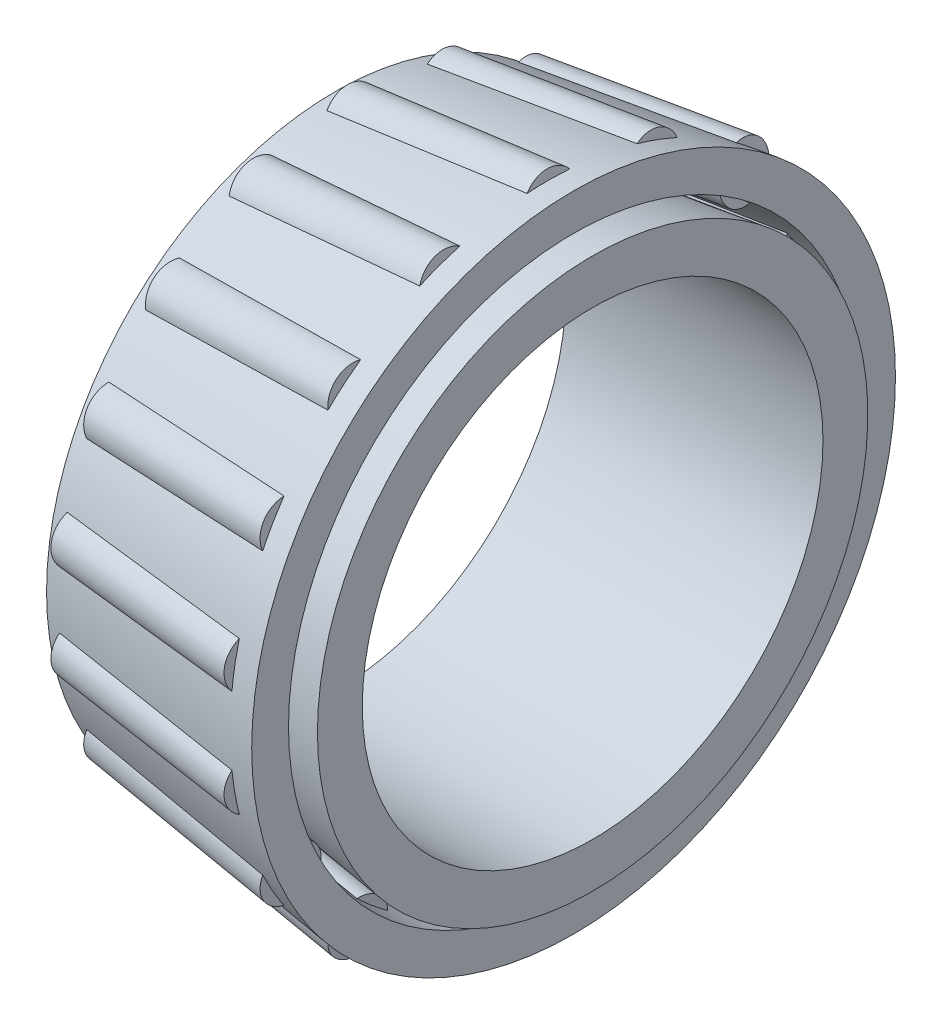
from build123d import *

# Parameters (mm, degrees)
CIRPATTERN1_COUNT = 18
CIRPATTERN6_COUNT = 18


with BuildPart() as part:
    # Sketch2 → Revolve1 (revolve)
    with BuildSketch(Plane.XY):
        Polygon((-7.38505, 14.9733), (-7.38505, 14.2875), (8.56615, 14.2875), (8.56615, 17.0688), align=None)
        Polygon((-7.38505, 17.9197), (-7.38505, 15.741847143), (7.38505, 17.682186713), (7.38505, 19.9644), align=None)
    revolve(axis=Axis((-7.38505, 0, 0), (1, 0, 0)))

    # Sketch2<8> → Cut-Revolve2 (revolve, cut)
    with BuildSketch(Plane.XY):
        Polygon((-6.642569819, 18.655030259), (-6.436732305, 17.129203169), (5.948956707, 18.800060537), (5.743119193, 20.325887626), align=None)
    cut_revolve2 = revolve(axis=Axis((-7.38505, 16.830773572, 0), (0.9910230330532699, 0.1336912411412861, 0)), mode=Mode.SUBTRACT)

    # CirPattern1: Cut-Revolve2 ×18 about axis
    cirpattern1_axis = Axis((-7.38505, 0, 0), (-1, 0, 0))
    for i in range(1, CIRPATTERN1_COUNT):
        add(cut_revolve2.rotate(cirpattern1_axis, i * 360 / CIRPATTERN1_COUNT), mode=Mode.SUBTRACT)

    # Sketch2<13> → Revolve4 (revolve)
    with BuildSketch(Plane.XY):
        Polygon((-6.642569819, 18.655030259), (-6.436732305, 17.129203169), (5.948956707, 18.800060537), (5.743119193, 20.325887626), align=None)
    revolve4 = revolve(axis=Axis((-7.38505, 16.830773572, 0), (0.9910230330532699, 0.1336912411412861, 0)))

    # CirPattern6: Revolve4 ×18 about axis
    cirpattern6_axis = Axis((-7.38505, 0, 0), (-1, 0, 0))
    for i in range(1, CIRPATTERN6_COUNT):
        add(revolve4.rotate(cirpattern6_axis, i * 360 / CIRPATTERN6_COUNT))


solid = part.part
